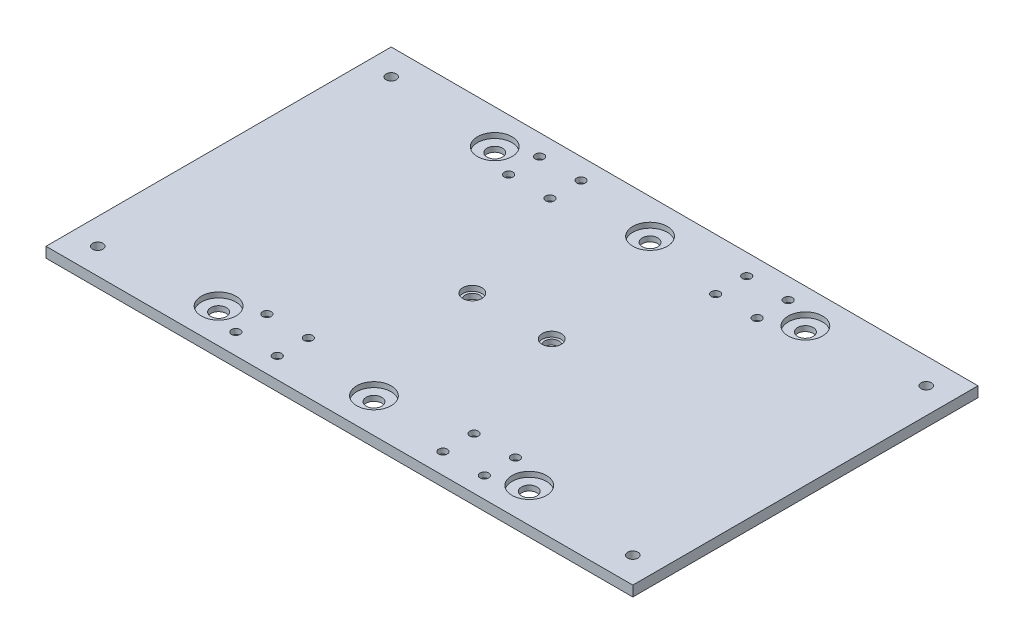
from build123d import *

# Parameters (mm, degrees)
SKETCH1_W           = 340
SKETCH1_H           = 200
SKETCH1_R           = 4.1
SKETCH1_R_2         = 1.5
SKETCH1_R_3         = 3
SKETCH1_R_4         = 4.5
BOSS_EXTRUDE1_DEPTH = 6
SKETCH2_R           = 2.5
SKETCH2_R_2         = 5.5
SKETCH2_R_3         = 10
CUT_EXTRUDE1_DEPTH  = 3


with BuildPart() as part:
    # Sketch1 → Boss-Extrude1 (new body)
    with BuildSketch(Plane(origin=(0, 0, 0), x_dir=(1, 0, 0), z_dir=(0, 1, 0))):
        Rectangle(SKETCH1_W, SKETCH1_H)
        with Locations((-23, 0)):
            Circle(SKETCH1_R, mode=Mode.SUBTRACT)
        with Locations((23, 0)):
            Circle(SKETCH1_R, mode=Mode.SUBTRACT)
        with Locations((72, 88)):
            Circle(SKETCH1_R_2, mode=Mode.SUBTRACT)
        with Locations((48, 88)):
            Circle(SKETCH1_R_2, mode=Mode.SUBTRACT)
        with Locations((72, 70)):
            Circle(SKETCH1_R_2, mode=Mode.SUBTRACT)
        with Locations((48, 70)):
            Circle(SKETCH1_R_2, mode=Mode.SUBTRACT)
        with Locations((-48, 70)):
            Circle(SKETCH1_R_2, mode=Mode.SUBTRACT)
        with Locations((-72, 70)):
            Circle(SKETCH1_R_2, mode=Mode.SUBTRACT)
        with Locations((-48, 88)):
            Circle(SKETCH1_R_2, mode=Mode.SUBTRACT)
        with Locations((-72, 88)):
            Circle(SKETCH1_R_2, mode=Mode.SUBTRACT)
        with Locations((-72, -88)):
            Circle(SKETCH1_R_2, mode=Mode.SUBTRACT)
        with Locations((-48, -88)):
            Circle(SKETCH1_R_2, mode=Mode.SUBTRACT)
        with Locations((-72, -70)):
            Circle(SKETCH1_R_2, mode=Mode.SUBTRACT)
        with Locations((-48, -70)):
            Circle(SKETCH1_R_2, mode=Mode.SUBTRACT)
        with Locations((48, -70)):
            Circle(SKETCH1_R_2, mode=Mode.SUBTRACT)
        with Locations((72, -70)):
            Circle(SKETCH1_R_2, mode=Mode.SUBTRACT)
        with Locations((48, -88)):
            Circle(SKETCH1_R_2, mode=Mode.SUBTRACT)
        with Locations((72, -88)):
            Circle(SKETCH1_R_2, mode=Mode.SUBTRACT)
        with Locations((155, 85)):
            Circle(SKETCH1_R_3, mode=Mode.SUBTRACT)
        with Locations((-155, 85)):
            Circle(SKETCH1_R_3, mode=Mode.SUBTRACT)
        with Locations((155, -85)):
            Circle(SKETCH1_R_3, mode=Mode.SUBTRACT)
        with Locations((-155, -85)):
            Circle(SKETCH1_R_3, mode=Mode.SUBTRACT)
        with Locations((0, 80)):
            Circle(SKETCH1_R_4, mode=Mode.SUBTRACT)
        with Locations((0, -80)):
            Circle(SKETCH1_R_4, mode=Mode.SUBTRACT)
        with Locations((90, 80)):
            Circle(SKETCH1_R_4, mode=Mode.SUBTRACT)
        with Locations((90, -80)):
            Circle(SKETCH1_R_4, mode=Mode.SUBTRACT)
        with Locations((-90, -80)):
            Circle(SKETCH1_R_4, mode=Mode.SUBTRACT)
        with Locations((-90, 80)):
            Circle(SKETCH1_R_4, mode=Mode.SUBTRACT)
    extrude(amount=BOSS_EXTRUDE1_DEPTH)

    # Sketch2 → Cut-Extrude1 (cut)
    with BuildSketch(Plane(origin=(0, 6, 0), x_dir=(1, 0, 0), z_dir=(0, 1, 0))):
        with Locations((72, 88)):
            Circle(SKETCH2_R)
        with Locations((48, 88)):
            Circle(SKETCH2_R)
        with Locations((48, 70)):
            Circle(SKETCH2_R)
        with Locations((72, 70)):
            Circle(SKETCH2_R)
        with Locations((-72, 70)):
            Circle(SKETCH2_R)
        with Locations((-48, 70)):
            Circle(SKETCH2_R)
        with Locations((-48, 88)):
            Circle(SKETCH2_R)
        with Locations((-72, 88)):
            Circle(SKETCH2_R)
        with Locations((-72, -88)):
            Circle(SKETCH2_R)
        with Locations((-48, -88)):
            Circle(SKETCH2_R)
        with Locations((-48, -70)):
            Circle(SKETCH2_R)
        with Locations((-72, -70)):
            Circle(SKETCH2_R)
        with Locations((72, -70)):
            Circle(SKETCH2_R)
        with Locations((48, -70)):
            Circle(SKETCH2_R)
        with Locations((48, -88)):
            Circle(SKETCH2_R)
        with Locations((72, -88)):
            Circle(SKETCH2_R)
        with Locations((23, 0)):
            Circle(SKETCH2_R_2)
        with Locations((-23, 0)):
            Circle(SKETCH2_R_2)
        with Locations((0, 80)):
            Circle(SKETCH2_R_3)
        with Locations((0, -80)):
            Circle(SKETCH2_R_3)
        with Locations((90, 80)):
            Circle(SKETCH2_R_3)
        with Locations((90, -80)):
            Circle(SKETCH2_R_3)
        with Locations((-90, -80)):
            Circle(SKETCH2_R_3)
        with Locations((-90, 80)):
            Circle(SKETCH2_R_3)
    extrude(amount=-CUT_EXTRUDE1_DEPTH, mode=Mode.SUBTRACT)


solid = part.part
